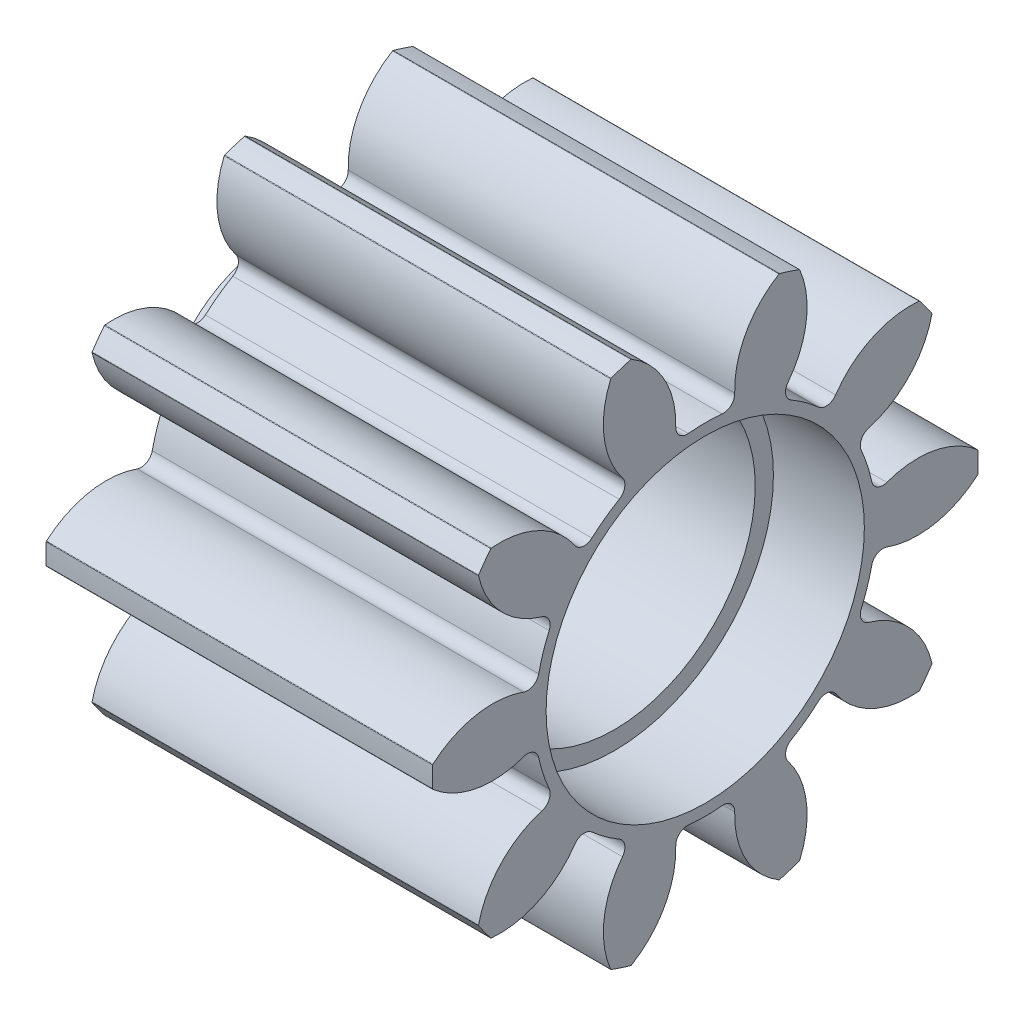
from build123d import *
from build123d.topology import SkipClean

# Parameters (mm, degrees)
BASPROSKE_W                = 8.5
BASPROSKE_H                = 6
TOOTHCUT_DEPTH             = 13.010412149
BREAKS_R                   = 0.02
ROOTFILLETS_R              = 0.251
TEETHCUTS_COUNT            = 10
TEETHCUTS_ANGLE            = 324
BREAKS_OF_TEETHCUTS_R      = 0.02
ROOTFILLETS_OF_TEETHCUTS_R = 0.251
BORSKE_R                   = 1.8
BORE_DEPTH                 = 50.0000508
SKETCH3_R                  = 2.5
SKETCH3_R_2                = 1.8
BOSS_EXTRUDE1_DEPTH        = 1
SKETCH4_R                  = 3.5
CUT_EXTRUDE2_DEPTH         = 2
SKETCH5_R                  = 3.1
CUT_EXTRUDE3_DEPTH         = 3


with BuildPart() as part:
    # BasProSke → Base-Revolve (revolve)
    with BuildSketch(Plane(origin=(0, 0, 0), x_dir=(1, 0, 0), z_dir=(0, 1, 0))):
        with Locations((4.25, 3)):
            Rectangle(BASPROSKE_W, BASPROSKE_H)
    revolve(axis=Axis((-10, 0, 0), (1, 0, 0)))

    # TooCutSke → ToothCut (cut, through all)
    with BuildSketch(Plane(origin=(0, 0, 0), x_dir=(0, 0, -1), z_dir=(1, 0, 0))):
        with BuildLine():
            ThreePointArc((0.680948119, 3.686639481), (0, 3.749), (-0.680948119, 3.686639481))
            ThreePointArc((-0.680948119, 3.686639481), (-0.833594699, 4.896067871), (-1.659981216, 5.7922282))
            ThreePointArc((-1.659981216, 5.7922282), (0, 6.0254), (1.659981216, 5.7922282))
            ThreePointArc((1.659981216, 5.7922282), (0.833594699, 4.896067871), (0.680948119, 3.686639481))
        make_face()
    toothcut = extrude(amount=TOOTHCUT_DEPTH, mode=Mode.SUBTRACT)

    # Breaks
    breaks_edges = [part.edges().sort_by_distance(p)[0] for p in [
        (4.25, 5.774516397, -1.629404918),
        (4.25, 5.774516397, 1.629404918),
    ]]
    fillet(breaks_edges, radius=BREAKS_R)

    # RootFillets
    rootfillets_edges = [part.edges().sort_by_distance(p)[0] for p in [
        (4.25, 3.686639481, -0.680948119),
        (4.25, 3.686639481, 0.680948119),
    ]]
    fillet(rootfillets_edges, radius=ROOTFILLETS_R)

    # TeethCuts: ToothCut ×10 about axis
    teethcuts_axis = Axis((-10, 0, 0), (1, 0, 0))
    for i in range(1, TEETHCUTS_COUNT):
        add(toothcut.rotate(teethcuts_axis, i * TEETHCUTS_ANGLE / (TEETHCUTS_COUNT - 1)), mode=Mode.SUBTRACT)

    # Breaks of TeethCuts
    breaks_of_teethcuts_edges = [part.edges().sort_by_distance(p)[0] for p in [
        (4.25, 5.62942208, 2.075959308),
        (4.25, 3.713941719, 4.712391846),
        (4.25, 3.334079865, 4.988377637),
        (4.25, 0.234767536, 5.995405258),
        (4.25, -0.234767536, 5.995405258),
        (4.25, -3.334079865, 4.988377637),
        (4.25, -3.713941719, 4.712391846),
        (4.25, -5.62942208, 2.075959308),
        (4.25, -5.774516397, 1.629404918),
        (4.25, -5.774516397, -1.629404918),
        (4.25, -5.62942208, -2.075959308),
        (4.25, -3.713941719, -4.712391846),
        (4.25, -3.334079865, -4.988377637),
        (4.25, -0.234767536, -5.995405258),
        (4.25, 0.234767536, -5.995405258),
        (4.25, 3.334079865, -4.988377637),
        (4.25, 3.713941719, -4.712391846),
        (4.25, 5.62942208, -2.075959308),
    ]]
    fillet(breaks_of_teethcuts_edges, radius=BREAKS_OF_TEETHCUTS_R)

    # RootFillets of TeethCuts
    rootfillets_of_teethcuts_edges = [part.edges().sort_by_distance(p)[0] for p in [
        (4.25, 3.382805254, 1.616053717),
        (4.25, 2.58230273, 2.717850918),
        (4.25, 1.786854397, 3.29577796),
        (4.25, 0.491614106, 3.716627042),
        (4.25, -0.491614106, 3.716627042),
        (4.25, -1.786854397, 3.29577796),
        (4.25, -2.58230273, 2.717850918),
        (4.25, -3.382805254, 1.616053717),
        (4.25, -3.686639481, 0.680948119),
        (4.25, -3.686639481, -0.680948119),
        (4.25, -3.382805254, -1.616053717),
        (4.25, -2.58230273, -2.717850918),
        (4.25, -1.786854397, -3.29577796),
        (4.25, -0.491614106, -3.716627042),
        (4.25, 0.491614106, -3.716627042),
        (4.25, 1.786854397, -3.29577796),
        (4.25, 2.58230273, -2.717850918),
        (4.25, 3.382805254, -1.616053717),
    ]]
    fillet(rootfillets_of_teethcuts_edges, radius=ROOTFILLETS_OF_TEETHCUTS_R)

    # BorSke → Bore (cut, symmetric)
    with BuildSketch(Plane(origin=(0, 0, 0), x_dir=(0, 0, -1), z_dir=(1, 0, 0))):
        Circle(BORSKE_R)
    extrude(amount=BORE_DEPTH, both=True, mode=Mode.SUBTRACT)

    # Sketch3 → Boss-Extrude1 (add)
    with SkipClean():  # the faces are left unmerged after this step: merging them gives an invalid solid
        with BuildSketch(Plane.ZY):
            Circle(SKETCH3_R)
            Circle(SKETCH3_R_2, mode=Mode.SUBTRACT)
        extrude(amount=BOSS_EXTRUDE1_DEPTH)

    # Sketch4 → Cut-Extrude2 (cut)
    with SkipClean():  # the faces are left unmerged after this step: merging them gives an invalid solid
        with BuildSketch(Plane(origin=(8.5, 0, 0), x_dir=(0, 0, -1), z_dir=(1, 0, 0))):
            Circle(SKETCH4_R)
        extrude(amount=-CUT_EXTRUDE2_DEPTH, mode=Mode.SUBTRACT)

    # Sketch5 → Cut-Extrude3 (cut)
    with SkipClean():  # the faces are left unmerged after this step: merging them gives an invalid solid
        with BuildSketch(Plane(origin=(6.5, 0, 0), x_dir=(0, 0, -1), z_dir=(1, 0, 0))):
            Circle(SKETCH5_R)
        extrude(amount=-CUT_EXTRUDE3_DEPTH, mode=Mode.SUBTRACT)


solid = part.part
